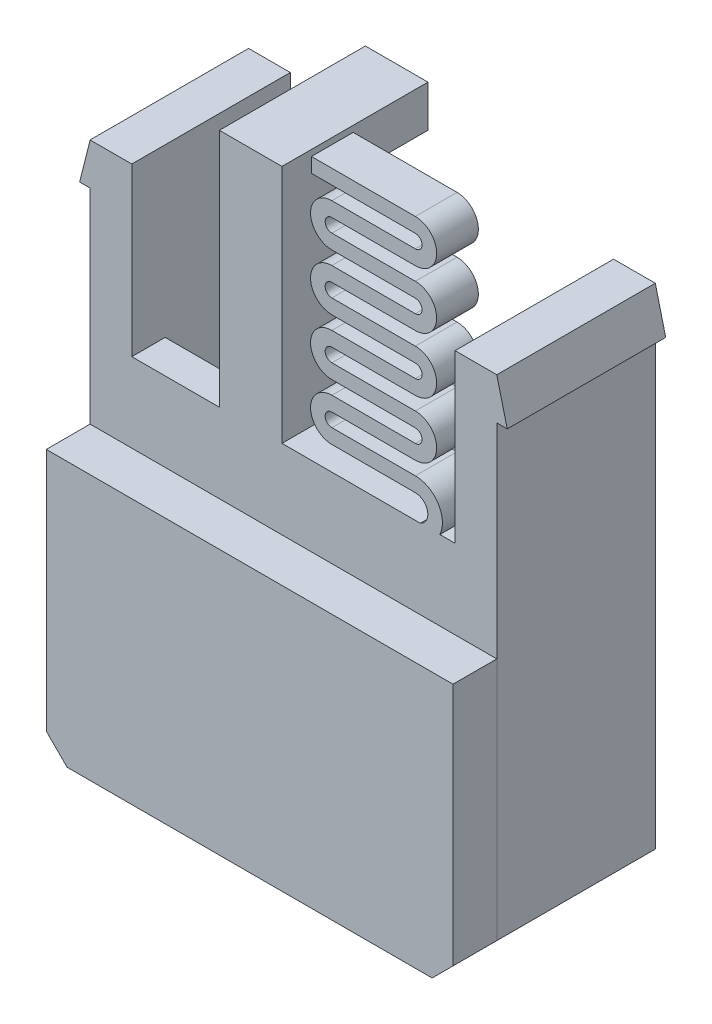
from build123d import *

# Parameters (mm, degrees)
SKETCH_1_W           = 19.5
SKETCH_1_H           = 12.7
EXTRUDE_1_DEPTH      = 2.1
SKETCH_2_W           = 19.5
SKETCH_2_H           = 24.5
EXTRUDE_2_DEPTH      = 7.6
SKETCH_3_W           = 15.5
SKETCH_3_H           = 6
CUT_EXTRUDE_1_DEPTH  = 23
CUT_EXTRUDE_2_REACH  = 68.224
SKETCH_4_W           = 15.5
SKETCH_4_H           = 8
EXTRUDE_4_DEPTH      = 7.6
EXTRUDE_5_DEPTH      = 2
EXTRUDE_6_DEPTH      = 11.5
EXTRUDE_6_DEPTH_BACK = 4
SKETCH_8_W           = 3
SKETCH_8_H           = 3
SKETCH_9_W           = 3
SKETCH_9_H           = 2
EXTRUDE_7_DEPTH      = 4
CHAMFER_1_SIZE       = 1


# Read off the part's stored shape, not the designer's step: 分割1
with BuildPart() as part:
    # 草图1 → 凸台-拉伸1 (new body)
    with BuildSketch(Plane.XY):
        with Locations((-53.015330564, -13.356843897)):
            Rectangle(SKETCH_1_W, SKETCH_1_H)
    extrude(amount=EXTRUDE_1_DEPTH)

    # 草图2 → 凸台-拉伸2 (add)
    with BuildSketch(Plane(origin=(0, 0, 0), x_dir=(-1, 0, 0), z_dir=(0, 0, -1))):
        with Locations((53.015330564, -7.456843897)):
            Rectangle(SKETCH_2_W, SKETCH_2_H)
    extrude(amount=EXTRUDE_2_DEPTH)

    # 草图3 → 切除-拉伸1 (cut)
    with BuildSketch(Plane(origin=(0, 4.793156103, 0), x_dir=(1, 0, 0), z_dir=(0, 1, 0))):
        with Locations((-53.015330564, 4.6)):
            Rectangle(SKETCH_3_W, SKETCH_3_H)
    extrude(amount=-CUT_EXTRUDE_1_DEPTH, mode=Mode.SUBTRACT)

    # 草图4 → 切除-拉伸2 (cut, up to next)
    with BuildSketch(Plane.XY, mode=Mode.PRIVATE) as cut_extrude_2_sk1:
        with Locations((-53.015330564, 0.793156103)):
            Rectangle(SKETCH_4_W, SKETCH_4_H)
    cut_extrude_2_tool1 = extrude(cut_extrude_2_sk1.sketch, amount=-CUT_EXTRUDE_2_REACH, mode=Mode.PRIVATE) & part.part
    add(cut_extrude_2_tool1.solids().sort_by_distance((-53.015331, 0.793156, 0))[0], mode=Mode.SUBTRACT)

    # 草图5 → 凸台-拉伸4 (add)
    with BuildSketch(Plane(origin=(0, 0, -7.6), x_dir=(-1, 0, 0), z_dir=(0, 0, -1))):
        Polygon((62.765330564, 4.793156103), (63.265330564, 2.793156103), (62.765330564, 2.793156103), align=None)
        Polygon((43.265330564, 4.793156103), (42.765330564, 2.793156103), (43.265330564, 2.793156103), align=None)
    extrude(amount=-EXTRUDE_4_DEPTH)

    # 草图7 → 凸台-拉伸5 (add)
    with BuildSketch(Plane.XY):
        with BuildLine():
            Line((-47.171144023, -1.356843897), (-51.171144023, -1.356843897))
            ThreePointArc((-51.171144023, -1.356843897), (-51.494269023, -1.033718897), (-51.171144023, -0.710593897))
            Line((-51.171144023, -0.710593897), (-47.171144023, -0.710593897))
            ThreePointArc((-47.171144023, -0.710593897), (-46.148019023, 0.312531103), (-47.171144023, 1.335656103))
            Line((-47.171144023, 1.335656103), (-51.171144023, 1.335656103))
            ThreePointArc((-51.171144023, 1.335656103), (-51.494269023, 1.658781103), (-51.171144023, 1.981906103))
            Line((-51.171144023, 1.981906103), (-47.171144023, 1.981906103))
            ThreePointArc((-47.171144023, 1.981906103), (-46.148019023, 3.005031103), (-47.171144023, 4.028156103))
            Line((-47.171144023, 4.028156103), (-51.171144023, 4.028156103))
            ThreePointArc((-51.171144023, 4.028156103), (-51.494269023, 4.351281103), (-51.171144023, 4.674406103))
            Line((-51.171144023, 4.674406103), (-47.171144023, 4.674406103))
            ThreePointArc((-47.171144023, 4.674406103), (-46.148019023, 5.697531103), (-47.171144023, 6.720656103))
            Line((-47.171144023, 6.720656103), (-51.171144023, 6.720656103))
            ThreePointArc((-51.171144023, 6.720656103), (-51.494269023, 7.043781103), (-51.171144023, 7.366906103))
            Line((-51.171144023, 7.366906103), (-47.171144023, 7.366906103))
            ThreePointArc((-47.171144023, 7.366906103), (-46.148019023, 8.390031103), (-47.171144023, 9.413156103))
            Line((-47.171144023, 9.413156103), (-52.150877486, 9.413156103))
            Line((-52.150877486, 9.413156103), (-52.150877486, 8.713156103))
            Line((-52.150877486, 8.713156103), (-47.171144023, 8.713156103))
            ThreePointArc((-47.171144023, 8.713156103), (-46.848019023, 8.390031103), (-47.171144023, 8.066906103))
            Line((-47.171144023, 8.066906103), (-51.171144023, 8.066906103))
            ThreePointArc((-51.171144023, 8.066906103), (-52.194269023, 7.043781103), (-51.171144023, 6.020656103))
            Line((-51.171144023, 6.020656103), (-47.171144023, 6.020656103))
            ThreePointArc((-47.171144023, 6.020656103), (-46.848019023, 5.697531103), (-47.171144023, 5.374406103))
            Line((-47.171144023, 5.374406103), (-51.171144023, 5.374406103))
            ThreePointArc((-51.171144023, 5.374406103), (-52.194269023, 4.351281103), (-51.171144023, 3.328156103))
            Line((-51.171144023, 3.328156103), (-47.171144023, 3.328156103))
            ThreePointArc((-47.171144023, 3.328156103), (-46.848019023, 3.005031103), (-47.171144023, 2.681906103))
            Line((-47.171144023, 2.681906103), (-51.171144023, 2.681906103))
            ThreePointArc((-51.171144023, 2.681906103), (-52.194269023, 1.658781103), (-51.171144023, 0.635656103))
            Line((-51.171144023, 0.635656103), (-47.171144023, 0.635656103))
            ThreePointArc((-47.171144023, 0.635656103), (-46.848019023, 0.312531103), (-47.171144023, -0.010593897))
            Line((-47.171144023, -0.010593897), (-51.171144023, -0.010593897))
            ThreePointArc((-51.171144023, -0.010593897), (-52.194269023, -1.033718897), (-51.171144023, -2.056843897))
            Line((-51.171144023, -2.056843897), (-47.171144023, -2.056843897))
            ThreePointArc((-47.171144023, -2.056843897), (-46.583777016, -2.53436941), (-46.931352446, -3.206843897))
            Line((-46.931352446, -3.206843897), (-47.396871104, -3.937096718))
            ThreePointArc((-47.396871104, -3.937096718), (-45.876090227, -2.770138498), (-47.171144023, -1.356843897))
        make_face()
    extrude(amount=-EXTRUDE_5_DEPTH)

    # 草图8 → 凸台-拉伸6 (add, two sides: drawn at the far end of the back side and taken through both)
    with BuildSketch(Plane(origin=(0, -3.206843897, 0), x_dir=(1, 0, 0), z_dir=(0, 1, 0)).offset(-EXTRUDE_6_DEPTH_BACK)):
        with Locations((-55.065330564, 1.5)):
            Rectangle(SKETCH_8_W, SKETCH_8_H)
    extrude(amount=EXTRUDE_6_DEPTH + EXTRUDE_6_DEPTH_BACK)

    # 草图9 → 凸台-拉伸7 (add)
    with BuildSketch(Plane(origin=(0, 0, -3), x_dir=(-1, 0, 0), z_dir=(0, 0, -1))):
        with Locations((55.065330564, 7.293156103)):
            Rectangle(SKETCH_9_W, SKETCH_9_H)
    extrude(amount=EXTRUDE_7_DEPTH)

    # 倒角1
    chamfer_1_edges = [part.edges().sort_by_distance(p)[0] for p in [
        (-43.265330564, -19.706843897, -2.75),
        (-62.765330564, -19.706843897, -2.75),
    ]]
    chamfer(chamfer_1_edges, length=CHAMFER_1_SIZE)


with BuildPart() as body_2:
    # Split Bodies 1: the piece on the far side of the plane
    add(part.part)
    split(bisect_by=Plane.XY, keep=Keep.BOTTOM)


with BuildPart() as part_1:
    add(part.part)

    # Split Bodies 1
    split(bisect_by=Plane.XY, keep=Keep.TOP)


solid = Compound([body_2.part, part_1.part])
